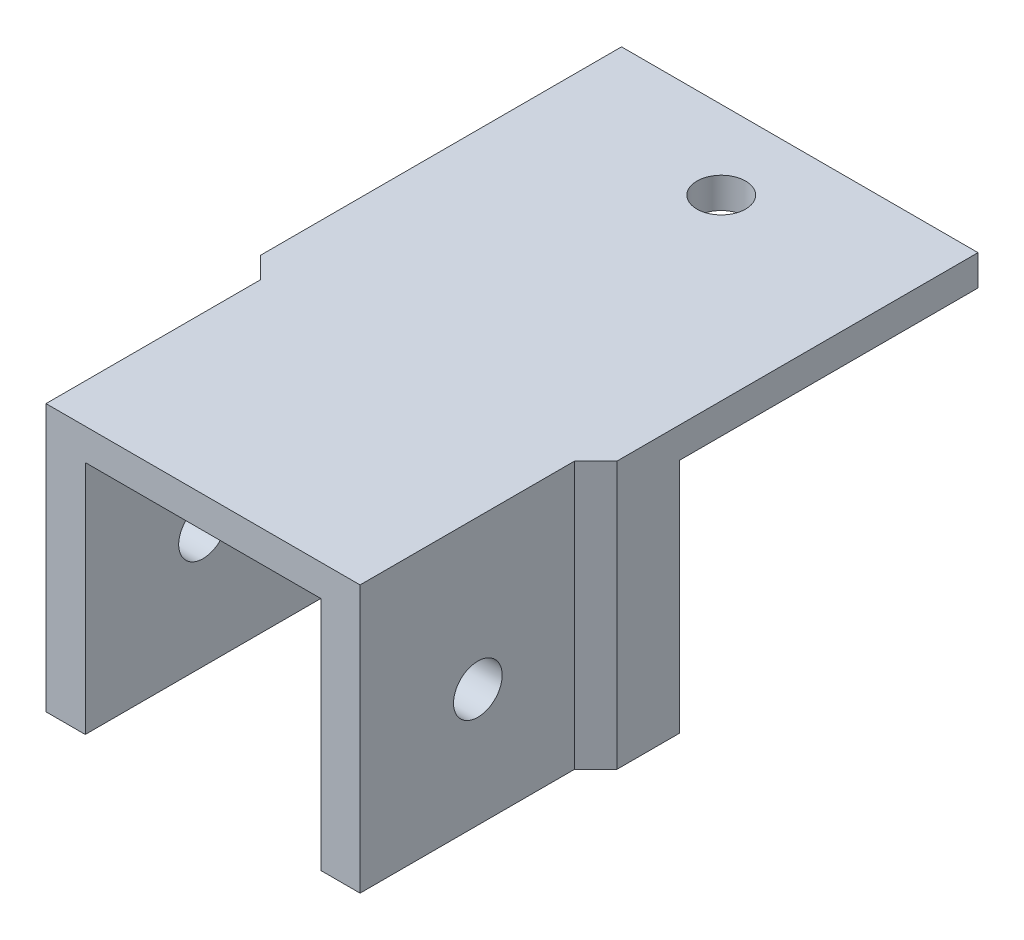
from build123d import *

# Parameters (mm, degrees)
SKETCH1_R           = 1.6
BOSS_EXTRUDE1_DEPTH = 5
SKETCH3_W           = 45.4
SKETCH3_H           = 34
SKETCH3_R           = 3
BOSS_EXTRUDE2_DEPTH = 3
BOSS_EXTRUDE3_DEPTH = 30
SKETCH5_R           = 3.1
CUT_EXTRUDE2_DEPTH  = 63.178452859
SKETCH6_W           = 45.4
SKETCH6_H           = 38
SKETCH6_R           = 3.1
BOSS_EXTRUDE4_DEPTH = 3.9
SKETCH9_W           = 2.7
SKETCH9_H           = 34
CUT_EXTRUDE3_DEPTH  = 30
CHAMFER1_SIZE       = 2.7


with BuildPart() as part:
    # Sketch1 → Boss-Extrude1 (new body)
    with BuildSketch(Plane.XY):
        Polygon((22.7, 15), (22.7, 19), (-22.7, 19), (-22.7, 15), (-22.7, -15), (22.7, -15), align=None)
        with Locations((-10, 10)):
            Circle(SKETCH1_R, mode=Mode.SUBTRACT)
        with Locations((10, 10)):
            Circle(SKETCH1_R, mode=Mode.SUBTRACT)
        with Locations((10, -10)):
            Circle(SKETCH1_R, mode=Mode.SUBTRACT)
        with Locations((-10, -10)):
            Circle(SKETCH1_R, mode=Mode.SUBTRACT)
    extrude(amount=BOSS_EXTRUDE1_DEPTH)

    # Sketch3 → Boss-Extrude2 (add)
    with BuildSketch(Plane.XY.offset(5)):
        with Locations((0, 2)):
            Rectangle(SKETCH3_W, SKETCH3_H)
        with Locations((10, -10)):
            Circle(SKETCH3_R, mode=Mode.SUBTRACT)
        with Locations((10, 10)):
            Circle(SKETCH3_R, mode=Mode.SUBTRACT)
        with Locations((-10, 10)):
            Circle(SKETCH3_R, mode=Mode.SUBTRACT)
        with Locations((-10, -10)):
            Circle(SKETCH3_R, mode=Mode.SUBTRACT)
    extrude(amount=BOSS_EXTRUDE2_DEPTH)

    # Sketch2 → Boss-Extrude3 (add)
    with BuildSketch(Plane.XY.offset(8)):
        Polygon((15, 15), (15, -15), (22.7, -15), (22.7, 19), (-22.7, 19), (-22.7, -15), (-15, -15), (-15, 15), align=None)
    extrude(amount=BOSS_EXTRUDE3_DEPTH)

    # Sketch5 → Cut-Extrude2 (cut, through all)
    with BuildSketch(Plane(origin=(22.7, 0, 0), x_dir=(0, 0, -1), z_dir=(1, 0, 0))):
        with Locations((-23, 0)):
            Circle(SKETCH5_R)
    extrude(amount=-CUT_EXTRUDE2_DEPTH, mode=Mode.SUBTRACT)

    # Sketch6 → Boss-Extrude4 (add)
    with BuildSketch(Plane(origin=(0, 19, 0), x_dir=(1, 0, 0), z_dir=(0, 1, 0))):
        with Locations((0, 19)):
            Rectangle(SKETCH6_W, SKETCH6_H)
        with Locations(Location((0, 28, 0), (0, 0, 270))):
            Circle(SKETCH6_R, mode=Mode.SUBTRACT)
    extrude(amount=-BOSS_EXTRUDE4_DEPTH)

    # Sketch9 → Cut-Extrude3 (cut)
    with BuildSketch(Plane.XY.offset(38)):
        with Locations((-21.35, 2)):
            Rectangle(SKETCH9_W, SKETCH9_H)
        with Locations((21.35, 2)):
            Rectangle(SKETCH9_W, SKETCH9_H)
    extrude(amount=-CUT_EXTRUDE3_DEPTH, mode=Mode.SUBTRACT)

    # Chamfer1
    chamfer1_edges = [part.edges().sort_by_distance(p)[0] for p in [
        (20, 2, 8),
        (-20, 2, 8),
    ]]
    chamfer(chamfer1_edges, length=CHAMFER1_SIZE - 0.0001)  # a hair under: the kernel refuses the full size


solid = part.part
